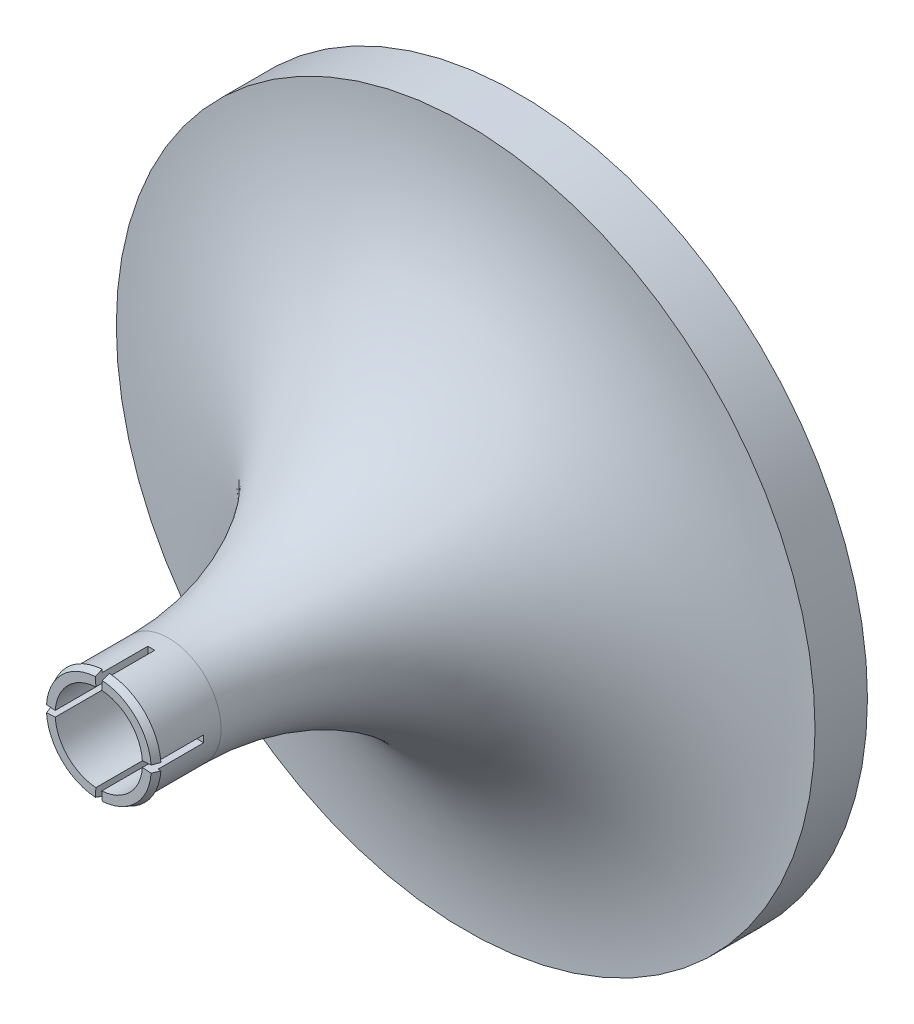
from build123d import *

# Parameters (mm, degrees)
SKETCH_3_R               = 12.5
CUT_EXTRUDE_1_DEPTH      = 186.472370018
CUT_EXTRUDE_3_DEPTH      = 15
PATTERN_CIRCULAR_1_COUNT = 4
SKETCH_10_R              = 12.5
SKETCH_10_R_2            = 5
EXTRUDE_1_DEPTH          = 30
SKETCH_12_R              = 2.5
PATTERN_CIRCULAR_4_COUNT = 9


with BuildPart() as part:
    # Sweep 1: sweep along a path in 草图2
    with BuildLine(Plane.XY) as sweep_1_path:
        CenterArc((0, 0), 50, 0, 360)
    # 草图1 → Sweep 1 (sweep)
    with BuildSketch(Plane(origin=(0, 0, 0), x_dir=(1, 0, 0), z_dir=(0, 1, 0))):
        with BuildLine():
            Line((0, 0), (0, 120))
            Line((0, 120), (100, 120))
            Line((100, 120), (100, 105))
            ThreePointArc((100, 105), (39.895923599, 80.104076401), (15, 20))
            Line((15, 20), (15, 0))
            Line((15, 0), (0, 0))
        make_face()
    sweep(path=sweep_1_path.line)

    # 草图3 → 切除-拉伸1 (cut, through all)
    with BuildSketch(Plane.XY):
        Circle(SKETCH_3_R)
    extrude(amount=-CUT_EXTRUDE_1_DEPTH, mode=Mode.SUBTRACT)

    # 草图5 → 切除-拉伸3 (cut)
    with BuildSketch(Plane.XY):
        Polygon((0, 15), (-1, 15), (0, 0), (1, 15), align=None)
    cut_extrude_3 = extrude(amount=-CUT_EXTRUDE_3_DEPTH, mode=Mode.SUBTRACT)

    # 阵列(圆周)1: 切除-拉伸3 ×4 about axis
    pattern_circular_1_axis = Axis((0, 0, -20), (0, 0, 1))
    for i in range(1, PATTERN_CIRCULAR_1_COUNT):
        add(cut_extrude_3.rotate(pattern_circular_1_axis, i * 360 / PATTERN_CIRCULAR_1_COUNT), mode=Mode.SUBTRACT)

    # 扫描4: sweep along a curve in space
    with BuildLine() as sweep_4_path:
        ThreePointArc((14.966777368, 0.997785158, 0), (10.606601718, 10.606601718, 0), (0.997785158, 14.966777368, 0))
    # 草图6 → 扫描4 (sweep)
    with BuildSketch(Plane(origin=(0, 0, 0), x_dir=(0, 0, 1), z_dir=(-0.997785157856609, 0.06651901052377394, 0))):
        Polygon((0, 15), (-2, 15), (-2, 15.8), align=None)
    sweep(path=sweep_4_path.line)

    # 扫描5: sweep along a curve in space
    with BuildLine() as sweep_5_path:
        ThreePointArc((-14.966777368, -0.997785158, 0), (-10.606601718, -10.606601718, 0), (-0.997785158, -14.966777368, 0))
    # 草图7 → 扫描5 (sweep)
    with BuildSketch(Plane(origin=(0, 0, 0), x_dir=(0, 0, -1), z_dir=(0.997785157856609, -0.06651901052377394, 0))):
        Polygon((0, -15), (2, -15), (2, -15.8), align=None)
    sweep(path=sweep_5_path.line)

    # 扫描6: sweep along a curve in space
    with BuildLine() as sweep_6_path:
        ThreePointArc((-0.997785158, 14.966777368, 0), (-10.606601718, 10.606601718, 0), (-14.966777368, 0.997785158, 0))
    # 草图8 → 扫描6 (sweep)
    with BuildSketch(Plane(origin=(0, 0, 0), x_dir=(0, 0, -1), z_dir=(0.997785157856609, 0.06651901052377394, 0))):
        Polygon((0, 15), (2, 15), (2, 15.8), align=None)
    sweep(path=sweep_6_path.line)

    # 扫描7: sweep along a curve in space
    with BuildLine() as sweep_7_path:
        ThreePointArc((0.997785158, -14.966777368, 0), (10.606601718, -10.606601718, 0), (14.966777368, -0.997785158, 0))
    # 草图9 → 扫描7 (sweep)
    with BuildSketch(Plane(origin=(0, 0, 0), x_dir=(0.9977851578566097, -0.06651901052376351, 0), z_dir=(0.0665190105237635, 0.9977851578566096, 0))):
        Polygon((15, 0), (15, 2), (15.8, 2), align=None)
    sweep(path=sweep_7_path.line)

    # Sweep 1 2: sweep along a path in 草图11
    with BuildLine(Plane(origin=(0, 0, 0), x_dir=(1, 0, 0), z_dir=(0, 1, 0))) as sweep_1_2_path:
        Line((50, 120), (50, 108.620499352))
        ThreePointArc((50, 108.620499352), (49.402715777, 105.216246714), (47.682212796, 102.218655355))
        Line((47.682212796, 102.218655355), (0, 45))
    # 草图12 → Sweep 1 2 (sweep, cut)
    with BuildSketch(Plane(origin=(0, 0, -120), x_dir=(-1, 0, 0), z_dir=(0, 0, -1))):
        with Locations((-50, 0)):
            Circle(SKETCH_12_R)
    sweep_1_2 = sweep(path=sweep_1_2_path.line, mode=Mode.SUBTRACT)

    # 阵列(圆周)4: Sweep 1 2 ×9 about axis
    pattern_circular_4_axis = Axis((0, 0, -120), (0, 0, 1))
    for i in range(1, PATTERN_CIRCULAR_4_COUNT):
        add(sweep_1_2.rotate(pattern_circular_4_axis, i * 360 / PATTERN_CIRCULAR_4_COUNT), mode=Mode.SUBTRACT)


with BuildPart() as body_2:
    # 草图10 → 凸台-拉伸1 (new body)
    with BuildSketch(Plane(origin=(0, 0, -120), x_dir=(-1, 0, 0), z_dir=(0, 0, -1))):
        Circle(SKETCH_10_R)
        Circle(SKETCH_10_R_2, mode=Mode.SUBTRACT)
    extrude(amount=-EXTRUDE_1_DEPTH)


solid = Compound([part.part, body_2.part])
